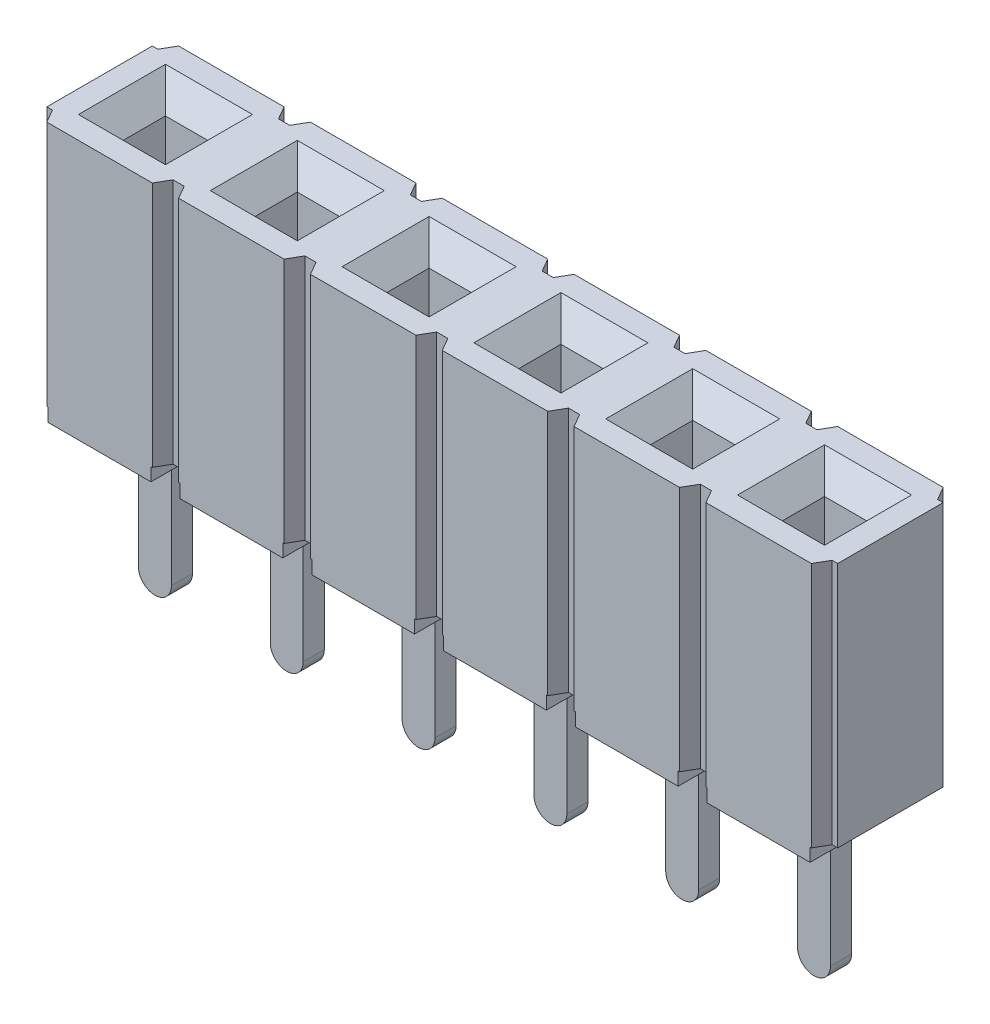
from build123d import *

# Parameters (mm, degrees)
SKETCH1_W                      = 40.64
SKETCH1_H                      = 2.54
BASE_EXTRUDE_DEPTH             = 5
SKETCH2_W                      = 1.524
SKETCH2_H                      = 0.254
STANDOFF_WIDTH_DEPTH           = 41.966114046
UPPER_START                    = -19.4945
UPPER_CORE_OUTLINE_W           = 3.3528
UPPER_CORE_OUTLINE_H           = 0.889
UPPER_CORE_DEPTH               = 0.889
LEAD_IN_SIZE                   = 0.3937
LEAD_IN_SIZE2                  = 0.469193389
CORE_PATTERN_COUNT             = 16
CORE_PATTERN_PITCH             = 2.54
LEAD_IN_OF_CORE_PATTERN_SIZE2  = 0.469193389
LEAD_IN_OF_CORE_PATTERN_SIZE   = 0.3937
POSITION_CUT_DEPTH             = 21.964620197
SKETCH10_W                     = 0.2794
SKETCH10_H                     = 0.254
STANDOFF_LENGTH_DEPTH          = 22.07970588
STANDOFF_PATTERN_COUNT         = 16
STANDOFF_PATTERN_PITCH         = 2.54
SKETCH11_W                     = 0.635
SKETCH11_H                     = 0.4064
TAIL_DEPTH                     = 3.175
TAIL_FILLETS_R                 = 0.3175
TAIL_PATTERN_COUNT             = 16
TAIL_PATTERN_PITCH             = 2.54
TAIL_FILLETS_OF_TAIL_PATTERN_R = 0.3175
SKETCH12_W                     = 25.4
SKETCH12_H                     = 7.921
CUT_EXTRUDE1_DEPTH             = 22.07970588


# Read off the part's stored shape, not the designer's step: Upper Core
with BuildPart() as part:
    # Sketch1 → Base-Extrude (new body)
    with BuildSketch(Plane(origin=(0, 0, 0), x_dir=(1, 0, 0), z_dir=(0, 1, 0))):
        Rectangle(SKETCH1_W, SKETCH1_H)
    extrude(amount=BASE_EXTRUDE_DEPTH)

    # Sketch2 → Standoff - Width (cut, through all)
    with BuildSketch(Plane.ZY.offset(20.32)):
        with Locations((0, 0.127)):
            Rectangle(SKETCH2_W, SKETCH2_H)
    extrude(amount=-STANDOFF_WIDTH_DEPTH, mode=Mode.SUBTRACT)

    # Upper Core outline → Upper Core (cut)
    with BuildSketch(Plane.YZ.offset(UPPER_START)):
        with Locations((3.3236, 0)):
            Rectangle(UPPER_CORE_OUTLINE_W, UPPER_CORE_OUTLINE_H)
    upper_core = extrude(amount=UPPER_CORE_DEPTH, mode=Mode.SUBTRACT)

    # Lead-in
    lead_in_edges = [part.edges().sort_by_distance(p)[0] for p in [
        (-19.4945, 5, 0),
        (-19.05, 5, 0.4445),
        (-18.6055, 5, 0),
        (-19.05, 5, -0.4445),
    ]]
    lead_in_side = [part.faces().sort_by_distance(p)[0] for p in [
        (0.146976854, 5, 0),
    ]]
    chamfer(lead_in_edges, length=LEAD_IN_SIZE, length2=LEAD_IN_SIZE2, reference=lead_in_side[0])

    # Core Pattern: Upper Core ×16
    with Locations(*[(i * CORE_PATTERN_PITCH, 0, 0) for i in range(1, CORE_PATTERN_COUNT)]):
        add(upper_core, mode=Mode.SUBTRACT)

    # Lead-in of Core Pattern
    lead_in_of_core_pattern_edges = [part.edges().sort_by_distance(p)[0] for p in [
        (-16.9545, 5, 0),
        (-16.51, 5, 0.4445),
        (-16.0655, 5, 0),
        (-16.51, 5, -0.4445),
        (-14.4145, 5, 0),
        (-13.97, 5, 0.4445),
        (-13.5255, 5, 0),
        (-13.97, 5, -0.4445),
        (-11.8745, 5, 0),
        (-11.43, 5, 0.4445),
        (-10.9855, 5, 0),
        (-11.43, 5, -0.4445),
        (-9.3345, 5, 0),
        (-8.89, 5, 0.4445),
        (-8.4455, 5, 0),
        (-8.89, 5, -0.4445),
        (-6.7945, 5, 0),
        (-6.35, 5, 0.4445),
        (-5.9055, 5, 0),
        (-6.35, 5, -0.4445),
        (-4.2545, 5, 0),
        (-3.81, 5, 0.4445),
        (-3.3655, 5, 0),
        (-3.81, 5, -0.4445),
        (-1.7145, 5, 0),
        (-1.27, 5, 0.4445),
        (-0.8255, 5, 0),
        (-1.27, 5, -0.4445),
        (0.8255, 5, 0),
        (1.27, 5, 0.4445),
        (1.7145, 5, 0),
        (1.27, 5, -0.4445),
        (3.3655, 5, 0),
        (3.81, 5, 0.4445),
        (4.2545, 5, 0),
        (3.81, 5, -0.4445),
        (5.9055, 5, 0),
        (6.35, 5, 0.4445),
        (6.7945, 5, 0),
        (6.35, 5, -0.4445),
        (8.4455, 5, 0),
        (8.89, 5, 0.4445),
        (9.3345, 5, 0),
        (8.89, 5, -0.4445),
        (10.9855, 5, 0),
        (11.43, 5, 0.4445),
        (11.8745, 5, 0),
        (11.43, 5, -0.4445),
        (13.5255, 5, 0),
        (13.97, 5, 0.4445),
        (14.4145, 5, 0),
        (13.97, 5, -0.4445),
        (16.0655, 5, 0),
        (16.51, 5, 0.4445),
        (16.9545, 5, 0),
        (16.51, 5, -0.4445),
        (18.6055, 5, 0),
        (19.05, 5, 0.4445),
        (19.4945, 5, 0),
        (19.05, 5, -0.4445),
    ]]
    chamfer(lead_in_of_core_pattern_edges, length=LEAD_IN_OF_CORE_PATTERN_SIZE, length2=LEAD_IN_OF_CORE_PATTERN_SIZE2)

    # Sketch4 → Position Cut (cut, through all)
    with BuildSketch(Plane(origin=(0, 5, 0), x_dir=(-1, 0, 0), z_dir=(0, 1, 0))):
        Polygon((20.32, 1.016), (20.212646968, 1.016), (20.066, 1.27), (20.32, 1.27), align=None)
        Polygon((20.066, -1.27), (20.32, -1.27), (20.32, -1.016), (20.212646968, -1.016), align=None)
        Polygon((17.78, -1.016), (17.887353032, -1.016), (18.034, -1.27), (17.78, -1.27), align=None)
        Polygon((18.034, 1.27), (17.78, 1.27), (17.78, 1.016), (17.887353032, 1.016), align=None)
    position_cut = extrude(amount=-POSITION_CUT_DEPTH, mode=Mode.SUBTRACT)

    # Sketch10 → Standoff - Length (cut, through all)
    with BuildSketch(Plane.XY.offset(1.27)):
        with Locations((-17.9197, 0.127)):
            Rectangle(SKETCH10_W, SKETCH10_H)
        with Locations((-20.1803, 0.127)):
            Rectangle(SKETCH10_W, SKETCH10_H)
    standoff_length = extrude(amount=-STANDOFF_LENGTH_DEPTH, mode=Mode.SUBTRACT)

    # Standoff Pattern: Position Cut, Standoff - Length ×16
    with Locations(*[(i * STANDOFF_PATTERN_PITCH, 0, 0) for i in range(1, STANDOFF_PATTERN_COUNT)]):
        add(position_cut, mode=Mode.SUBTRACT)
        add(standoff_length, mode=Mode.SUBTRACT)

    # Sketch11 → Tail (add)
    with BuildSketch(Plane.XZ.offset(-0.254)):
        with Locations((-19.05, 0)):
            Rectangle(SKETCH11_W, SKETCH11_H)
    tail = extrude(amount=TAIL_DEPTH)

    # Tail Fillets
    tail_fillets_edges = [part.edges().sort_by_distance(p)[0] for p in [
        (-19.3675, -2.921, 0),
        (-18.7325, -2.921, 0),
    ]]
    fillet(tail_fillets_edges, radius=TAIL_FILLETS_R - 0.0001)  # a hair under: the kernel refuses the full size

    # Tail Pattern: Tail ×16
    with Locations(*[(i * TAIL_PATTERN_PITCH, 0, 0) for i in range(1, TAIL_PATTERN_COUNT)]):
        add(tail)

    # Tail Fillets of Tail Pattern
    tail_fillets_of_tail_pattern_edges = [part.edges().sort_by_distance(p)[0] for p in [
        (-16.8275, -2.921, 0),
        (-16.1925, -2.921, 0),
        (-14.2875, -2.921, 0),
        (-13.6525, -2.921, 0),
        (-11.7475, -2.921, 0),
        (-11.1125, -2.921, 0),
        (-9.2075, -2.921, 0),
        (-8.5725, -2.921, 0),
        (-6.6675, -2.921, 0),
        (-6.0325, -2.921, 0),
        (-4.1275, -2.921, 0),
        (-3.4925, -2.921, 0),
        (-1.5875, -2.921, 0),
        (-0.9525, -2.921, 0),
        (0.9525, -2.921, 0),
        (1.5875, -2.921, 0),
        (3.4925, -2.921, 0),
        (4.1275, -2.921, 0),
        (6.0325, -2.921, 0),
        (6.6675, -2.921, 0),
        (8.5725, -2.921, 0),
        (9.2075, -2.921, 0),
        (11.1125, -2.921, 0),
        (11.7475, -2.921, 0),
        (13.6525, -2.921, 0),
        (14.2875, -2.921, 0),
        (16.1925, -2.921, 0),
        (16.8275, -2.921, 0),
        (18.7325, -2.921, 0),
        (19.3675, -2.921, 0),
    ]]
    fillet(tail_fillets_of_tail_pattern_edges, radius=TAIL_FILLETS_OF_TAIL_PATTERN_R - 0.0001)  # a hair under: the kernel refuses the full size

    # Sketch12 → Cut-Extrude1 (cut, through all)
    with BuildSketch(Plane.XY.offset(1.27)):
        with Locations((7.62, 1.0395)):
            Rectangle(SKETCH12_W, SKETCH12_H)
    extrude(amount=-CUT_EXTRUDE1_DEPTH, mode=Mode.SUBTRACT)


solid = part.part
